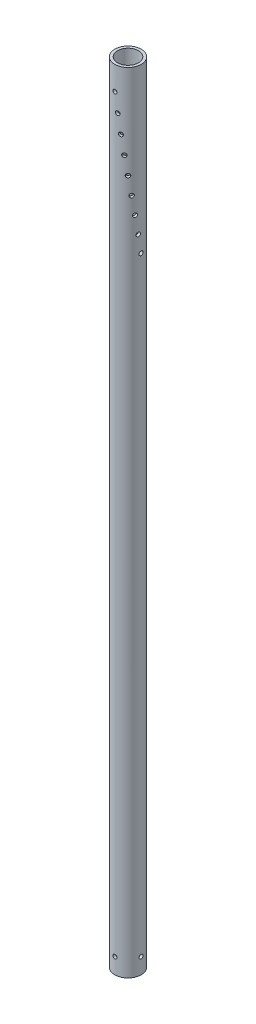
from build123d import *

# Parameters (mm, degrees)
SKETCH1_R                            = 16.7
SKETCH1_R_2                          = 13.32
BOSS_EXTRUDE1_DEPTH                  = 1000
F_8_0_199_DIAMETER_HOLE3_D           = 5.0546
F_8_0_199_DIAMETER_HOLE3_ON_FACE_2_D = 5.0546
F_8_0_199_DIAMETER_HOLE4_D           = 5.0546
F_8_0_199_DIAMETER_HOLE4_DEPTH       = 40
CRVPATTERN1_START                    = -16.7000001
CRVPATTERN1_OUTLINE_R                = 2.5273
CRVPATTERN1_DEPTH                    = 33.400000129
CRVPATTERN1_2_OUTLINE_R              = 2.5273
CRVPATTERN1_2_DEPTH                  = 33.400000129
CRVPATTERN1_3_OUTLINE_R              = 2.5273
CRVPATTERN1_3_DEPTH                  = 33.400000129
CRVPATTERN1_4_OUTLINE_R              = 2.5273
CRVPATTERN1_4_DEPTH                  = 33.400000129
CRVPATTERN1_5_OUTLINE_R              = 2.5273
CRVPATTERN1_5_DEPTH                  = 33.400000129
CRVPATTERN1_6_OUTLINE_R              = 2.5273
CRVPATTERN1_6_DEPTH                  = 33.400000129
CRVPATTERN1_7_OUTLINE_R              = 2.5273
CRVPATTERN1_7_DEPTH                  = 33.400000129
CRVPATTERN1_8_OUTLINE_R              = 2.5273
CRVPATTERN1_8_DEPTH                  = 33.400000129


# Read off the part's stored shape, not the designer's step: CrvPattern1
with BuildPart() as part:
    # Sketch1 → Boss-Extrude1 (new body)
    with BuildSketch(Plane(origin=(0, 0, 0), x_dir=(1, 0, 0), z_dir=(0, 1, 0))):
        with Locations(Location((0, 0, 0), (0, 0, 270))):
            Circle(SKETCH1_R)
        with Locations(Location((0, 0, 0), (0, 0, 270))):
            Circle(SKETCH1_R_2, mode=Mode.SUBTRACT)
    extrude(amount=BOSS_EXTRUDE1_DEPTH)

    # #8 (0.199) Diameter Hole3 (through all)
    with Locations(Plane(origin=(-16.7, 20, 0), x_dir=(0, 0, -1), z_dir=(-1, 0, 0))):
        with Locations((0, 0)):
            Hole(F_8_0_199_DIAMETER_HOLE3_D / 2)

    # #8 (0.199) Diameter Hole3 on face 2 (through all)
    with Locations(Plane(origin=(0, 20, -16.7), x_dir=(-1, 0, 0), z_dir=(0, 0, -1))):
        with Locations((0, 0)):
            Hole(F_8_0_199_DIAMETER_HOLE3_ON_FACE_2_D / 2)

    # #8 (0.199) Diameter Hole4
    with Locations(Plane(origin=(0, 970, -16.7), x_dir=(-1, 0, 0), z_dir=(0, 0, -1))):
        with Locations((0, 0)):
            Hole(F_8_0_199_DIAMETER_HOLE4_D / 2, depth=F_8_0_199_DIAMETER_HOLE4_DEPTH)

    # CrvPattern1 outline → CrvPattern1 (cut)
    with BuildSketch(Plane(origin=(0, 0, 0), x_dir=(0.9807852769477681, 0, -0.19509033938791004), z_dir=(0.19509033938791004, 0, 0.9807852769477681)).offset(CRVPATTERN1_START)):
        with Locations((0, 947.812492454)):
            Circle(CRVPATTERN1_OUTLINE_R)
    extrude(amount=CRVPATTERN1_DEPTH, mode=Mode.SUBTRACT)

    # CrvPattern1 2 outline → CrvPattern1 2 (cut)
    with BuildSketch(Plane(origin=(0, 0, 0), x_dir=(0.9238795164064432, 0, -0.38268347124561913), z_dir=(0.38268347124561913, 0, 0.9238795164064433)).offset(CRVPATTERN1_START)):
        with Locations((0, 925.625001005)):
            Circle(CRVPATTERN1_2_OUTLINE_R)
    extrude(amount=CRVPATTERN1_2_DEPTH, mode=Mode.SUBTRACT)

    # CrvPattern1 3 outline → CrvPattern1 3 (cut)
    with BuildSketch(Plane(origin=(0, 0, 0), x_dir=(0.8314696325832289, 0, -0.5555702026674131), z_dir=(0.555570202667413, 0, 0.831469632583229)).offset(CRVPATTERN1_START)):
        with Locations((0, 903.437500082)):
            Circle(CRVPATTERN1_3_OUTLINE_R)
    extrude(amount=CRVPATTERN1_3_DEPTH, mode=Mode.SUBTRACT)

    # CrvPattern1 4 outline → CrvPattern1 4 (cut)
    with BuildSketch(Plane(origin=(0, 0, 0), x_dir=(0.707106781186556, 0, -0.707106781186539), z_dir=(0.707106781186539, 0, 0.707106781186556)).offset(CRVPATTERN1_START)):
        with Locations((0, 881.25)):
            Circle(CRVPATTERN1_4_OUTLINE_R)
    extrude(amount=CRVPATTERN1_4_DEPTH, mode=Mode.SUBTRACT)

    # CrvPattern1 5 outline → CrvPattern1 5 (cut)
    with BuildSketch(Plane(origin=(0, 0, 0), x_dir=(0.5555702026674335, 0, -0.831469632583215), z_dir=(0.831469632583215, 0, 0.555570202667434)).offset(CRVPATTERN1_START)):
        with Locations((0, 859.062499918)):
            Circle(CRVPATTERN1_5_OUTLINE_R)
    extrude(amount=CRVPATTERN1_5_DEPTH, mode=Mode.SUBTRACT)

    # CrvPattern1 6 outline → CrvPattern1 6 (cut)
    with BuildSketch(Plane(origin=(0, 0, 0), x_dir=(0, 1, 0), z_dir=(0.923879516406435, 0, 0.382683471245639)).offset(CRVPATTERN1_START)):
        with Locations((836.874998995, 0)):
            Circle(CRVPATTERN1_6_OUTLINE_R)
    extrude(amount=CRVPATTERN1_6_DEPTH, mode=Mode.SUBTRACT)

    # CrvPattern1 7 outline → CrvPattern1 7 (cut)
    with BuildSketch(Plane(origin=(0, 0, 0), x_dir=(0, 1, 0), z_dir=(0.9807852769477641, 0, 0.19509033938793002)).offset(CRVPATTERN1_START)):
        with Locations((814.687507546, 0)):
            Circle(CRVPATTERN1_7_OUTLINE_R)
    extrude(amount=CRVPATTERN1_7_DEPTH, mode=Mode.SUBTRACT)

    # CrvPattern1 8 outline → CrvPattern1 8 (cut)
    with BuildSketch(Plane.YZ.offset(CRVPATTERN1_START)):
        with Locations((792.5, 0)):
            Circle(CRVPATTERN1_8_OUTLINE_R)
    extrude(amount=CRVPATTERN1_8_DEPTH, mode=Mode.SUBTRACT)


solid = part.part
